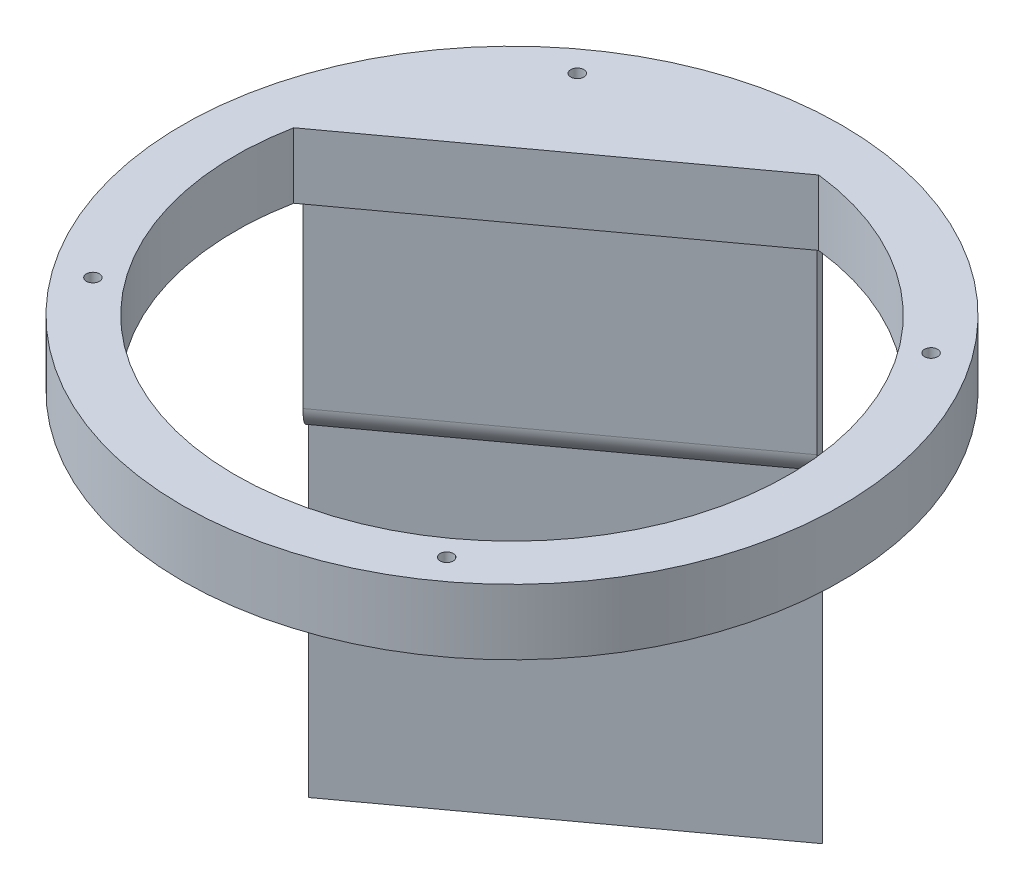
from build123d import *

# Parameters (mm, degrees)
SKETCH2_R           = 75.63
BOSS_EXTRUDE1_DEPTH = 15
SKETCH5_R           = 63.5
CUT_EXTRUDE1_DEPTH  = 109.003674937
BOSS_EXTRUDE2_START = -15
BOSS_EXTRUDE2_DEPTH = 15
BOSS_EXTRUDE3_DEPTH = 125
CUT_EXTRUDE4_DEPTH  = 100
SKETCH7_R           = 1.5
CUT_EXTRUDE2_DEPTH  = 15
SKETCH8_W           = 84.415638362
SKETCH8_H           = 49.5
BOSS_EXTRUDE4_DEPTH = 6
FILLET1_R           = 6


with BuildPart() as part:
    # Sketch2 → Boss-Extrude1 (new body)
    with BuildSketch(Plane(origin=(0, 0, 0), x_dir=(1, 0, 0), z_dir=(0, 1, 0))):
        with Locations(Location((0, 0, 0), (0, 0, 270))):
            Circle(SKETCH2_R)
    extrude(amount=BOSS_EXTRUDE1_DEPTH)

    # Sketch5 → Cut-Extrude1 (cut, through all)
    with BuildSketch(Plane(origin=(0, 15, 0), x_dir=(1, 0, 0), z_dir=(0, 1, 0))):
        with Locations(Location((0, 0, 0), (0, 0, 270))):
            Circle(SKETCH5_R)
    extrude(amount=-CUT_EXTRUDE1_DEPTH, mode=Mode.SUBTRACT)

    # Sketch6 → Boss-Extrude2 (add)
    with BuildSketch(Plane.XZ.offset(BOSS_EXTRUDE2_START)):
        with BuildLine():
            Line((7.313069509, -63.077484211), (-62.311802931, -12.226578243))
            ThreePointArc((-62.311802931, -12.226578243), (-37.452220614, -51.279441993), (7.313069509, -63.077484211))
        make_face()
    extrude(amount=BOSS_EXTRUDE2_DEPTH)

    # Sketch6<5> → Boss-Extrude3 (add)
    with BuildSketch(Plane.XZ):
        with BuildLine():
            Line((-8.246344057, -64.096711575), (-10.190161052, -62.677034213))
            ThreePointArc((-10.190161052, -62.677034213), (-37.452220614, -51.279441993), (-56.604547366, -28.778033593))
            Line((-56.604547366, -28.778033593), (-58.548364361, -27.358356231))
            ThreePointArc((-58.548364361, -27.358356231), (-49.90104688, -41.064292825), (-38.115744208, -52.187936044))
            ThreePointArc((-38.115744208, -52.187936044), (-23.933565149, -60.029784976), (-8.246344057, -64.096711575))
        make_face()
        with BuildLine():
            Line((0.687581465, -70.621652889), (-8.246344057, -64.096711575))
            ThreePointArc((-8.246344057, -64.096711575), (-23.933565149, -60.029784976), (-38.115744208, -52.187936044))
            Line((-38.115744208, -52.187936044), (-15.111189696, -68.989438112))
            ThreePointArc((-15.111189696, -68.989438112), (-7.25783369, -70.251081665), (0.687581465, -70.621652889))
        make_face()
        with BuildLine():
            Line((-61.120298719, -35.386433976), (-38.115744208, -52.187936044))
            ThreePointArc((-38.115744208, -52.187936044), (-49.90104688, -41.064292825), (-58.548364361, -27.358356231))
            Line((-58.548364361, -27.358356231), (-67.482289883, -20.833414917))
            ThreePointArc((-67.482289883, -20.833414917), (-64.711699404, -28.289336954), (-61.120298719, -35.386433976))
        make_face()
        with BuildLine():
            Line((-15.111189696, -68.989438112), (-38.115744208, -52.187936044))
            Line((-38.115744208, -52.187936044), (-41.654536706, -57.033237649))
            ThreePointArc((-41.654536706, -57.033237649), (-29.005596113, -64.393835257), (-15.111189696, -68.989438112))
        make_face()
        with BuildLine():
            Line((-41.654536706, -57.033237649), (-38.115744208, -52.187936044))
            Line((-38.115744208, -52.187936044), (-61.120298719, -35.386433976))
            ThreePointArc((-61.120298719, -35.386433976), (-52.514881, -47.223700602), (-41.654536706, -57.033237649))
        make_face()
        with BuildLine():
            ThreePointArc((-56.604547366, -28.778033593), (-37.452220614, -51.279441993), (-10.190161052, -62.677034213))
            Line((-10.190161052, -62.677034213), (-33.397354209, -45.727533903))
            Line((-33.397354209, -45.727533903), (-56.604547366, -28.778033593))
        make_face()
    extrude(amount=BOSS_EXTRUDE3_DEPTH)

    # Sketch6<14> → Cut-Extrude4 (cut)
    with BuildSketch(Plane.XZ):
        with BuildLine():
            Line((-15.111189696, -68.989438112), (-38.115744208, -52.187936044))
            Line((-38.115744208, -52.187936044), (-41.654536706, -57.033237649))
            ThreePointArc((-41.654536706, -57.033237649), (-29.005596113, -64.393835257), (-15.111189696, -68.989438112))
        make_face()
        with BuildLine():
            Line((-41.654536706, -57.033237649), (-38.115744208, -52.187936044))
            Line((-38.115744208, -52.187936044), (-61.120298719, -35.386433976))
            ThreePointArc((-61.120298719, -35.386433976), (-52.514881, -47.223700602), (-41.654536706, -57.033237649))
        make_face()
    extrude(amount=CUT_EXTRUDE4_DEPTH, mode=Mode.SUBTRACT)

    # Sketch7 → Cut-Extrude2 (cut)
    with BuildSketch(Plane(origin=(0, 15, 0), x_dir=(1, 0, 0), z_dir=(0, 1, 0))):
        with Locations(Location((40.592898957, -55.579647168, 0), (0, 0, 270))):
            Circle(SKETCH7_R)
        with Locations(Location((-55.579647168, -40.592898957, 0), (0, 0, 270))):
            Circle(SKETCH7_R)
        with Locations(Location((-40.592898957, 55.579647168, 0), (0, 0, 270))):
            Circle(SKETCH7_R)
        with Locations(Location((55.579647168, 40.592898957, 0), (0, 0, 270))):
            Circle(SKETCH7_R)
    extrude(amount=-CUT_EXTRUDE2_DEPTH, mode=Mode.SUBTRACT)

    # Sketch8 → Boss-Extrude4 (add)
    with BuildSketch(Plane(origin=(-33.397354209, 0, -45.727533903), x_dir=(0.8075502676015422, 0, -0.5897987498263095), z_dir=(0.5897987498263095, 0, 0.8075502676015424))):
        with Locations((0, -24.75)):
            Rectangle(SKETCH8_W, SKETCH8_H)
    extrude(amount=BOSS_EXTRUDE4_DEPTH)

    # Fillet1
    fillet1_edges = [part.edges().sort_by_distance(p)[0] for p in [
        (-29.85856171, -49.5, -40.882232297),
    ]]
    fillet(fillet1_edges, radius=FILLET1_R - 0.0001)  # a hair under: the kernel refuses the full size


solid = part.part
